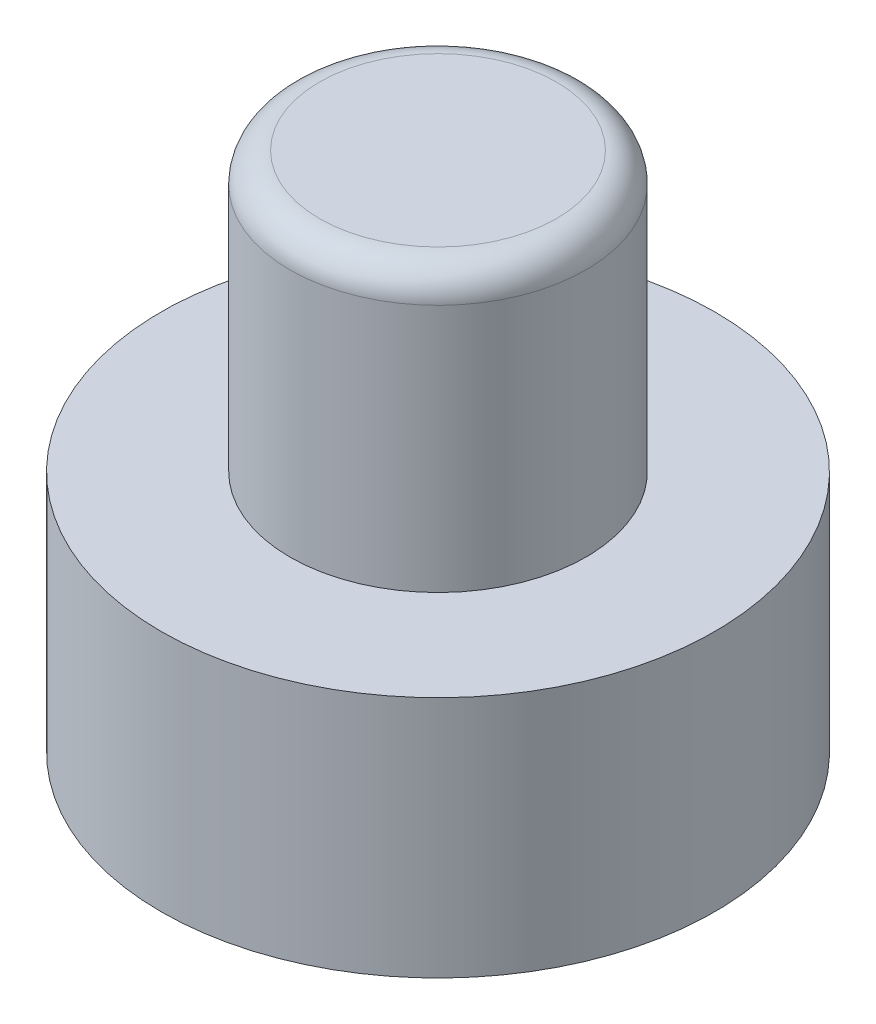
from build123d import *

# Parameters (mm, degrees)
SKETCH1_R           = 4.675
BOSS_EXTRUDE1_DEPTH = 4.1
SKETCH2_R           = 2.5
BOSS_EXTRUDE2_DEPTH = 4.7
FILLET1_R           = 0.5


with BuildPart() as part:
    # Sketch1 → Boss-Extrude1 (new body)
    with BuildSketch(Plane(origin=(0, 0, 0), x_dir=(1, 0, 0), z_dir=(0, 1, 0))):
        Circle(SKETCH1_R)
    extrude(amount=BOSS_EXTRUDE1_DEPTH)

    # Sketch2 → Boss-Extrude2 (add)
    with BuildSketch(Plane(origin=(0, 4.1, 0), x_dir=(1, 0, 0), z_dir=(0, 1, 0))):
        Circle(SKETCH2_R)
    extrude(amount=BOSS_EXTRUDE2_DEPTH)

    # Fillet1
    fillet1_edges = [part.edges().sort_by_distance(p)[0] for p in [
        (-2.5, 8.8, 0),
    ]]
    fillet(fillet1_edges, radius=FILLET1_R)


solid = part.part
